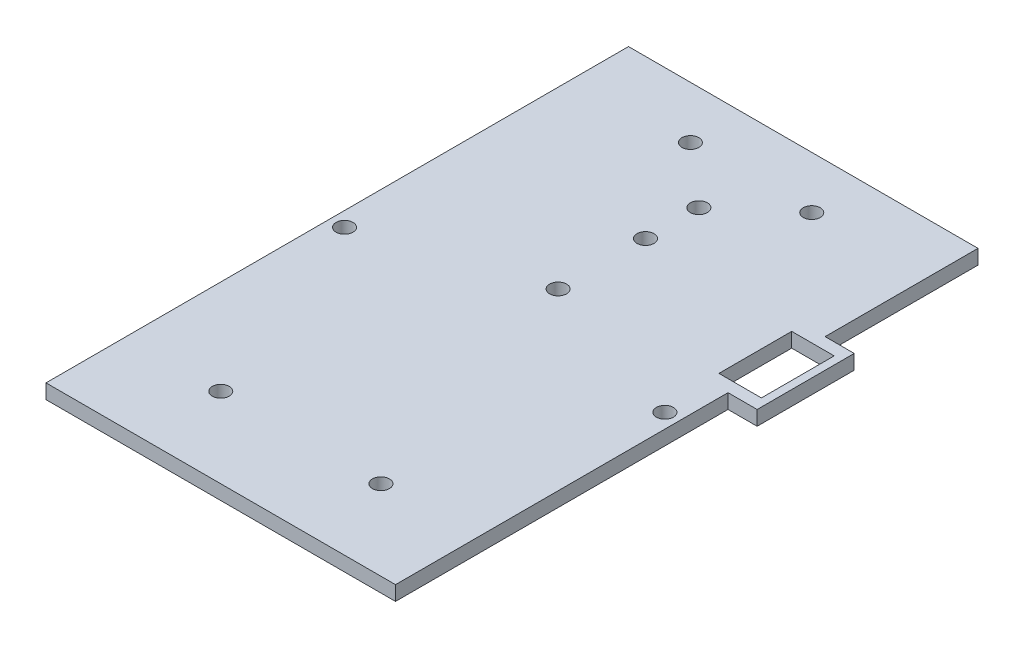
from build123d import *

# Parameters (mm, degrees)
SKETCH1_R           = 1.75
SKETCH1_W           = 8.75
SKETCH1_H           = 15
BOSS_EXTRUDE1_DEPTH = 3


with BuildPart() as part:
    # Sketch1 → Boss-Extrude1 (new body)
    with BuildSketch(Plane(origin=(0, 0, 0), x_dir=(1, 0, 0), z_dir=(0, 1, 0))):
        Polygon((-36, -60), (36, -60), (36, 8.5), (42, 8.5), (42, 28.5), (36, 28.5), (36, 60), (-36, 60), align=None)
        with Locations((-16.5, -43.5)):
            Circle(SKETCH1_R, mode=Mode.SUBTRACT)
        with Locations((-33, -1.5)):
            Circle(SKETCH1_R, mode=Mode.SUBTRACT)
        with Locations((16.5, -43.5)):
            Circle(SKETCH1_R, mode=Mode.SUBTRACT)
        with Locations((33, -1.5)):
            Circle(SKETCH1_R, mode=Mode.SUBTRACT)
        with Locations((0, 9.5)):
            Circle(SKETCH1_R, mode=Mode.SUBTRACT)
        with Locations((0, 27.5)):
            Circle(SKETCH1_R, mode=Mode.SUBTRACT)
        with Locations((0, 38.5)):
            Circle(SKETCH1_R, mode=Mode.SUBTRACT)
        with Locations((-12.5, 49.25)):
            Circle(SKETCH1_R, mode=Mode.SUBTRACT)
        with Locations((12.5, 49.25)):
            Circle(SKETCH1_R, mode=Mode.SUBTRACT)
        with Locations((36, 18.5)):
            Rectangle(SKETCH1_W, SKETCH1_H, mode=Mode.SUBTRACT)
    extrude(amount=BOSS_EXTRUDE1_DEPTH)


solid = part.part
